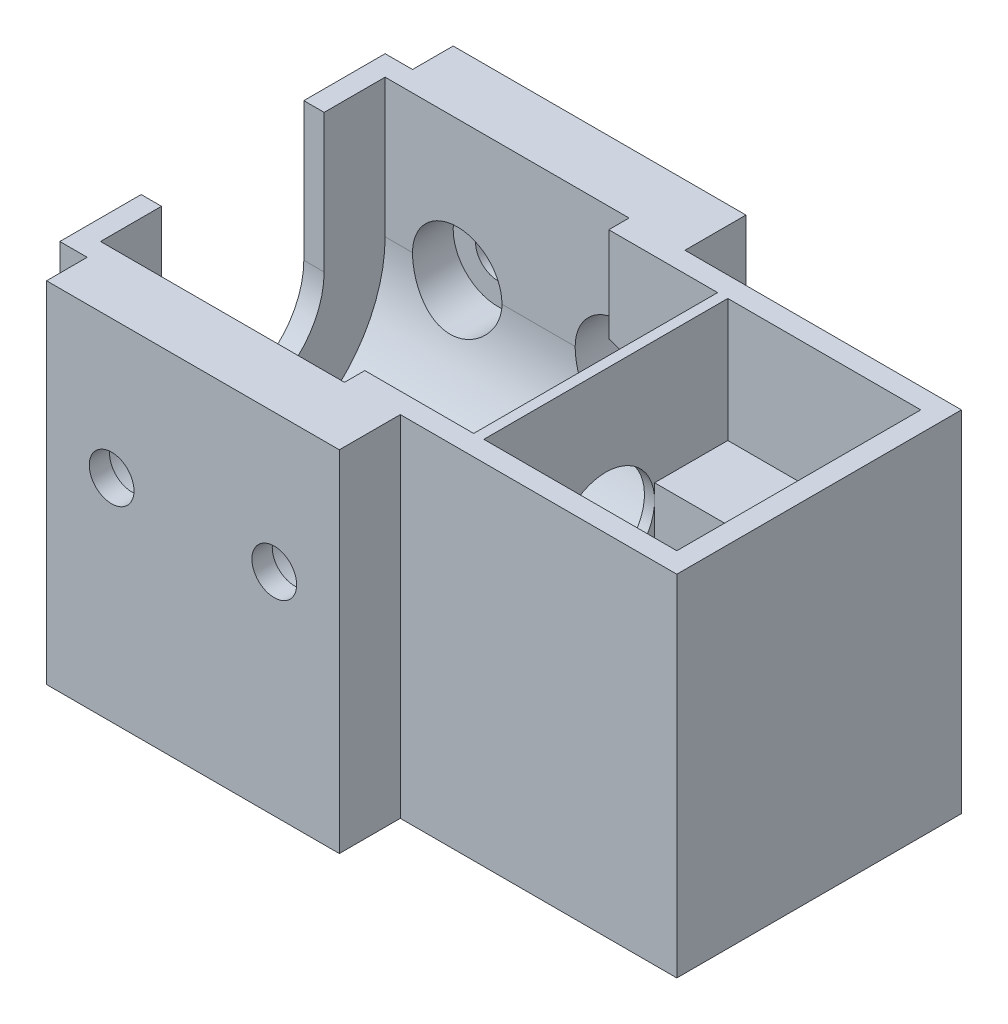
from build123d import *
from build123d.topology import SkipClean

# Parameters (mm, degrees)
SKETCH1_W                       = 116.84
SKETCH1_H                       = 50.8
BOSS_EXTRUDE1_DEPTH             = 31.75
SKETCH38_W                      = 20
SKETCH38_H                      = 20
CUT_EXTRUDE33_DEPTH             = 33.3134
SKETCH37_W                      = 63.5
SKETCH37_H                      = 25.4
CUT_EXTRUDE32_DEPTH             = 132.302277589
BOSS_EXTRUDE5_DEPTH             = 25.4
BOSS_EXTRUDE6_REACH             = 98.929
SKETCH40_W                      = 16.9009
SKETCH40_H                      = 20
SKETCH41_R                      = 3.113413941
CUT_EXTRUDE34_DEPTH             = 97.928543268
CUT_EXTRUDE35_DEPTH             = 97.928543399
CUT_EXTRUDE35_DEPTH_BACK        = 97.928543399
SKETCH42_R                      = 3.4925
SKETCH43_R                      = 6.985
CUT_EXTRUDE36_DEPTH             = 28.575
CUT_EXTRUDE37_START             = 28.575
SKETCH43_2_R                    = 6.985
CUT_EXTRUDE37_DEPTH             = 28.575
SKETCH44_W                      = 15.9125
SKETCH44_H                      = 38.1
CUT_EXTRUDE38_DEPTH             = 35.4
CUT_EXTRUDE39_REACH             = 98.929
SKETCH45_W                      = 14.2259
SKETCH45_H                      = 15.4
CUT_EXTRUDE39_DIRECTION_2_REACH = 98.929
SKETCH46_W                      = 43.18
SKETCH46_H                      = 9.525
SKETCH46_W_2                    = 27.94
SKETCH46_H_2                    = 6.35
CUT_EXTRUDE40_DEPTH             = 97.928543399
SKETCH49_W                      = 23.6641
SKETCH49_H                      = 50.8
CUT_EXTRUDE42_DEPTH             = 97.928543399
SKETCH50_W                      = 0.254
SKETCH50_H                      = 1.524
CUT_EXTRUDE43_DEPTH             = 2.54
SKETCH52_R                      = 0.3175
CUT_EXTRUDE45_DEPTH             = 0.0508
SKETCH53_R                      = 2
CUT_EXTRUDE46_DEPTH             = 0.0254
BOSS_EXTRUDE7_DEPTH             = 2.54
SKETCH55_W                      = 15.9125
SKETCH55_H                      = 9.05
BOSS_EXTRUDE8_DEPTH             = 17.46
CUT_EXTRUDE47_DEPTH             = 7.62
SKETCH58_R                      = 3.113413941
BOSS_EXTRUDE10_DEPTH            = 7.62
SKETCH59_W                      = 0.5
SKETCH59_H                      = 20
CUT_EXTRUDE48_DEPTH             = 7.62
CUT_EXTRUDE44_DEPTH             = 0.635
SKETCH60_W                      = 121.35651469
SKETCH60_H                      = 81.059088534
CUT_EXTRUDE49_DEPTH             = 10.16
SKETCH61_R                      = 8.976217823
SKETCH61_R_2                    = 7.62
BOSS_EXTRUDE11_DEPTH            = 1.5875
BOSS_EXTRUDE12_REACH            = 80.084
SKETCH62_W                      = 1.5875
SKETCH62_H                      = 15.24
SKETCH64_W                      = 30.1384
SKETCH64_H                      = 38.1
BOSS_EXTRUDE14_DEPTH            = 6.35
BOSS_EXTRUDE16_REACH            = 91.468
SKETCH65_W                      = 2.38
SKETCH65_H                      = 9.84
SKETCH66_W                      = 0.5
SKETCH66_H                      = 20
CUT_EXTRUDE50_DEPTH             = 20


with BuildPart() as part:
    # Sketch1 → Boss-Extrude1 (new, symmetric)
    with BuildSketch(Plane.XY):
        with Locations((-17.78, -25.4)):
            Rectangle(SKETCH1_W, SKETCH1_H)
    extrude(amount=BOSS_EXTRUDE1_DEPTH, both=True)

    # Sketch2 → Cut-Revolve1 (revolve, cut)
    with BuildSketch(Plane.XY, mode=Mode.PRIVATE) as cut_revolve1_sk:
        Polygon((-49.3609, -3.175), (-49.3609, -12.7), (-220.202391615, -12.7), (-220.202391615, -25.4), (-157.809194346, -25.4), (-128.417210056, -25.4), (6.8382, -25.4), (40.64, -25.4), (40.64, -17.78), (23.7391, -17.78), (5.7391, -17.78), (5.7391, -6.35), (-11.2609, -6.35), (-11.2609, -3.175), align=None)
    revolve(cut_revolve1_sk.sketch.rotate(Axis((-152.482877195, -25.4, 0), (1, 0, 0)), 180), axis=Axis((-152.482877195, -25.4, 0), (1, 0, 0)), mode=Mode.SUBTRACT)

    # Sketch38 → Cut-Extrude33 (cut)
    with BuildSketch(Plane(origin=(40.64, 0, 0), x_dir=(0, 0, -1), z_dir=(1, 0, 0))):
        with Locations((0, -25.4)):
            Rectangle(SKETCH38_W, SKETCH38_H)
    extrude(amount=-CUT_EXTRUDE33_DEPTH, mode=Mode.SUBTRACT)

    # Sketch37 → Cut-Extrude32 (cut, through all)
    with BuildSketch(Plane(origin=(40.64, 0, 0), x_dir=(0, 0, -1), z_dir=(1, 0, 0))):
        with Locations((0, -12.7)):
            Rectangle(SKETCH37_W, SKETCH37_H)
    extrude(amount=-CUT_EXTRUDE32_DEPTH, mode=Mode.SUBTRACT)

    # Sketch39 → Boss-Extrude5 (add)
    with BuildSketch(Plane(origin=(0, -25.4, 0), x_dir=(1, 0, 0), z_dir=(0, 1, 0))):
        Polygon((5.7391, 19.05), (5.7391, 7.62), (7.3266, 7.62), (7.3266, 10), (40.64, 10), (40.64, 31.75), (-76.2, 31.75), (-76.2, 12.7), (-49.3609, 12.7), (-49.3609, 22.225), (-11.2609, 22.225), (-11.2609, 19.05), align=None)
        Polygon((40.64, -10), (7.3266, -10), (7.3266, -7.62), (5.7391, -7.62), (5.7391, -19.05), (-11.2609, -19.05), (-11.2609, -22.225), (-49.3609, -22.225), (-49.3609, -12.7), (-76.2, -12.7), (-76.2, -31.75), (40.64, -31.75), align=None)
    extrude(amount=BOSS_EXTRUDE5_DEPTH)

    # Sketch40 → Boss-Extrude6 (add, up to next)
    with BuildSketch(Plane(origin=(0, 0, 0), x_dir=(1, 0, 0), z_dir=(0, 1, 0)), mode=Mode.PRIVATE) as boss_extrude6_sk1:
        with Locations((32.18955, 0)):
            Rectangle(SKETCH40_W, SKETCH40_H)
    boss_extrude6_tool1 = extrude(boss_extrude6_sk1.sketch, amount=-BOSS_EXTRUDE6_REACH, mode=Mode.PRIVATE) - part.part
    add(boss_extrude6_tool1.solids().sort_by_distance((32.18955, 0, 0))[0])

    # Sketch41 → Cut-Extrude34 (cut, through all)
    with BuildSketch(Plane(origin=(0, 0, 0), x_dir=(1, 0, 0), z_dir=(0, 1, 0))):
        with Locations(Location((-57.15, 0, 0), (0, 0, 270))):
            Circle(SKETCH41_R)
        with Locations(Location((-31.75, 0, 0), (0, 0, 270))):
            Circle(SKETCH41_R)
        with Locations(Location((-6.35, 0, 0), (0, 0, 270))):
            Circle(SKETCH41_R)
    extrude(amount=-CUT_EXTRUDE34_DEPTH, mode=Mode.SUBTRACT)

    # Sketch42 → Cut-Extrude35 (cut, two sides: drawn at the far end of the back side and taken through both)
    with BuildSketch(Plane.XY.offset(-CUT_EXTRUDE35_DEPTH_BACK)):
        with Locations((-38.1, -25.4)):
            Circle(SKETCH42_R)
        with Locations((-12.7, -25.4)):
            Circle(SKETCH42_R)
    extrude(amount=CUT_EXTRUDE35_DEPTH + CUT_EXTRUDE35_DEPTH_BACK, mode=Mode.SUBTRACT)

    # Sketch43 → Cut-Extrude36 (cut)
    with BuildSketch(Plane.XY):
        with Locations(Location((-38.1, -25.4, 0), (0, 0, 180))):
            Circle(SKETCH43_R)
        with Locations(Location((-12.7, -25.4, 0), (0, 0, 180))):
            Circle(SKETCH43_R)
    extrude(amount=-CUT_EXTRUDE36_DEPTH, mode=Mode.SUBTRACT)

    # Sketch43<2> → Cut-Extrude37 (cut)
    with BuildSketch(Plane.XY.offset(CUT_EXTRUDE37_START)):
        with Locations(Location((-38.1, -25.4, 0), (0, 0, 180))):
            Circle(SKETCH43_2_R)
        with Locations(Location((-12.7, -25.4, 0), (0, 0, 180))):
            Circle(SKETCH43_2_R)
    extrude(amount=-CUT_EXTRUDE37_DEPTH, mode=Mode.SUBTRACT)

    # Sketch44 → Cut-Extrude38 (cut)
    with BuildSketch(Plane(origin=(0, 0, 0), x_dir=(1, 0, 0), z_dir=(0, 1, 0))):
        with Locations((15.28285, 0)):
            Rectangle(SKETCH44_W, SKETCH44_H)
    extrude(amount=-CUT_EXTRUDE38_DEPTH, mode=Mode.SUBTRACT)

    # Cut-Extrude39: up to this face of the body (flat: up to its plane)
    cut_extrude39_end = Plane(part.part.faces().sort_by_distance((15.28285, -17.7, -19.05))[0])
    # Sketch45 → Cut-Extrude39 (cut, up to the picked face)
    with BuildSketch(Plane.XY, mode=Mode.PRIVATE) as cut_extrude39_sk1:
        with Locations((30.35205, -7.7)):
            Rectangle(SKETCH45_W, SKETCH45_H)
    cut_extrude39_tool1 = split(extrude(cut_extrude39_sk1.sketch, amount=-CUT_EXTRUDE39_REACH, mode=Mode.PRIVATE), bisect_by=cut_extrude39_end, keep=Keep.BOTH, mode=Mode.PRIVATE)
    add(cut_extrude39_tool1.solids().sort_by(Axis((30.35205, -7.7, 0), (0, 0, -1)))[0], mode=Mode.SUBTRACT)

    # Cut-Extrude39 direction 2: up to this face of the body (flat: up to its plane)
    cut_extrude39_direction_2_end = Plane(part.part.faces().sort_by_distance((15.28285, -17.7, 19.05))[0])
    # Sketch45 → Cut-Extrude39 direction 2 (cut, up to the picked face)
    with BuildSketch(Plane.XY, mode=Mode.PRIVATE) as cut_extrude39_direction_2_sk1:
        with Locations((30.35205, -7.7)):
            Rectangle(SKETCH45_W, SKETCH45_H)
    cut_extrude39_direction_2_tool1 = split(extrude(cut_extrude39_direction_2_sk1.sketch, amount=CUT_EXTRUDE39_DIRECTION_2_REACH, mode=Mode.PRIVATE), bisect_by=cut_extrude39_direction_2_end, keep=Keep.BOTH, mode=Mode.PRIVATE)
    add(cut_extrude39_direction_2_tool1.solids().sort_by(Axis((30.35205, -7.7, 0), (0, 0, 1)))[0], mode=Mode.SUBTRACT)

    # Sketch46 → Cut-Extrude40 (cut, through all)
    with BuildSketch(Plane(origin=(0, 0, 0), x_dir=(1, 0, 0), z_dir=(0, 1, 0))):
        with Locations((19.05, 26.9875)):
            Rectangle(SKETCH46_W, SKETCH46_H)
        with Locations((19.05, -26.9875)):
            Rectangle(SKETCH46_W, SKETCH46_H)
        with Locations((-62.23, 28.575)):
            Rectangle(SKETCH46_W_2, SKETCH46_H_2)
        with Locations((-62.23, -28.575)):
            Rectangle(SKETCH46_W_2, SKETCH46_H_2)
    extrude(amount=-CUT_EXTRUDE40_DEPTH, mode=Mode.SUBTRACT)

    # Sketch49 → Cut-Extrude42 (cut, through all)
    with BuildSketch(Plane(origin=(0, 0, 0), x_dir=(1, 0, 0), z_dir=(0, 1, 0))):
        with Locations((-64.36795, 0)):
            Rectangle(SKETCH49_W, SKETCH49_H)
    extrude(amount=-CUT_EXTRUDE42_DEPTH, mode=Mode.SUBTRACT)

    # Sketch50 → Cut-Extrude43 (cut)
    with BuildSketch(Plane(origin=(0, 0, 0), x_dir=(1, 0, 0), z_dir=(0, 1, 0))):
        with Locations((23.1121, 21.463)):
            Rectangle(SKETCH50_W, SKETCH50_H)
        with Locations((21.5881, 21.463)):
            Rectangle(SKETCH50_W, SKETCH50_H)
        with Locations((20.0641, 21.463)):
            Rectangle(SKETCH50_W, SKETCH50_H)
        with Locations((18.5401, 21.463)):
            Rectangle(SKETCH50_W, SKETCH50_H)
        with Locations((17.0161, 21.463)):
            Rectangle(SKETCH50_W, SKETCH50_H)
        with Locations((15.4921, 21.463)):
            Rectangle(SKETCH50_W, SKETCH50_H)
        with Locations((13.9681, 21.463)):
            Rectangle(SKETCH50_W, SKETCH50_H)
        with Locations((12.4441, 21.463)):
            Rectangle(SKETCH50_W, SKETCH50_H)
        with Locations((10.9201, 21.463)):
            Rectangle(SKETCH50_W, SKETCH50_H)
        with Locations((9.3961, 21.463)):
            Rectangle(SKETCH50_W, SKETCH50_H)
    extrude(amount=-CUT_EXTRUDE43_DEPTH, mode=Mode.SUBTRACT)

    # Sketch52 → Cut-Extrude45 (cut)
    with BuildSketch(Plane.ZY.offset(-23.7391)):
        with Locations(Location((0, -25.4, 0), (0, 0, 270))):
            Circle(SKETCH52_R)
    extrude(amount=-CUT_EXTRUDE45_DEPTH, mode=Mode.SUBTRACT)

    # Sketch53 → Cut-Extrude46 (cut)
    with BuildSketch(Plane.ZY.offset(-23.7391)):
        with Locations(Location((0, -25.4, 0), (0, 0, 270))):
            Circle(SKETCH53_R)
    extrude(amount=-CUT_EXTRUDE46_DEPTH, mode=Mode.SUBTRACT)

    # Sketch54 → Boss-Extrude7 (add)
    with BuildSketch(Plane(origin=(0, -35.4, 0), x_dir=(1, 0, 0), z_dir=(0, 1, 0))):
        Polygon((23.2391, 10), (23.2391, -10), (23.2391, -19.05), (7.3266, -19.05), (7.3266, 19.05), (23.2391, 19.05), align=None)
    extrude(amount=BOSS_EXTRUDE7_DEPTH)

    # Sketch55 → Boss-Extrude8 (add)
    with BuildSketch(Plane(origin=(0, -32.86, 0), x_dir=(1, 0, 0), z_dir=(0, 1, 0))):
        with Locations((15.28285, 14.525)):
            Rectangle(SKETCH55_W, SKETCH55_H)
        with Locations((15.28285, -14.525)):
            Rectangle(SKETCH55_W, SKETCH55_H)
    extrude(amount=BOSS_EXTRUDE8_DEPTH)

    # Sketch57 → Cut-Extrude47 (cut)
    with BuildSketch(Plane(origin=(0, -15.4, 0), x_dir=(1, 0, 0), z_dir=(0, 1, 0))):
        Polygon((23.7391, -10), (7.3266, -10), (7.3266, -19.05), (37.465, -19.05), (37.465, 19.05), (7.3266, 19.05), (7.3266, 10), (23.7391, 10), align=None)
    extrude(amount=-CUT_EXTRUDE47_DEPTH, mode=Mode.SUBTRACT)

    # Sketch58 → Boss-Extrude10 (add)
    with SkipClean():  # the faces are left unmerged after this step: merging them gives an invalid solid
        with BuildSketch(Plane.XZ.offset(50.8)):
            Polygon((-48.26, 25.4), (-52.5359, 25.4), (-52.5359, -25.4), (-48.26, -25.4), (-48.26, -31.75), (-2.54, -31.75), (-2.54, -22.225), (40.64, -22.225), (40.64, 22.225), (-2.54, 22.225), (-2.54, 31.75), (-48.26, 31.75), align=None)
            with Locations((-31.75, 0)):
                Circle(SKETCH58_R, mode=Mode.SUBTRACT)
            with Locations(Location((-6.35, 0, 0), (0, 0, 90))):
                Circle(SKETCH58_R, mode=Mode.SUBTRACT)
        extrude(amount=BOSS_EXTRUDE10_DEPTH)

    # Sketch59 → Cut-Extrude48 (cut)
    with SkipClean():  # the faces are left unmerged after this step: merging them gives an invalid solid
        with BuildSketch(Plane(origin=(0, -35.4, 0), x_dir=(1, 0, 0), z_dir=(0, 1, 0))):
            with Locations((23.4891, 0)):
                Rectangle(SKETCH59_W, SKETCH59_H)
        extrude(amount=-CUT_EXTRUDE48_DEPTH, mode=Mode.SUBTRACT)

    # Sketch51 → Cut-Extrude44 (cut)
    # profile 1 of 3: a face of its own
    with SkipClean():  # the faces are left unmerged after this step: merging them gives an invalid solid
        with BuildSketch(Plane(origin=(0, -23.02, 0), x_dir=(1, 0, 0), z_dir=(0, 1, 0))):
            Polygon((25.098, 0.254), (26.10821862, 0.254), (26.10821862, 2.54), (26.61621862, 2.54), (26.61621862, 0.254), (27.62643724, 0.254), (27.62643724, 2.54), (28.13443724, 2.54), (28.13443724, 0.254), (29.14465586, 0.254), (29.14465586, 2.54), (29.65265586, 2.54), (29.65265586, 0.254), (30.66287448, 0.254), (30.66287448, 2.54), (31.17087448, 2.54), (31.17087448, 0.254), (32.1810931, 0.254), (32.1810931, 2.54), (32.6890931, 2.54), (32.6890931, 0.254), (33.69931172, 0.254), (33.69931172, 2.54), (34.20731172, 2.54), (34.20731172, 0.254), (35.21753034, 0.254), (35.21753034, 2.54), (35.72553034, 2.54), (35.72553034, 0.254), (37.465, 0.254), (37.465, -0.254), (35.72553034, -0.254), (35.72553034, -2.54), (35.21753034, -2.54), (35.21753034, -0.254), (34.20731172, -0.254), (34.20731172, -2.54), (33.69931172, -2.54), (33.69931172, -0.254), (32.6890931, -0.254), (32.6890931, -2.54), (32.1810931, -2.54), (32.1810931, -0.254), (31.17087448, -0.254), (31.17087448, -2.54), (30.66287448, -2.54), (30.66287448, -0.254), (29.65265586, -0.254), (29.65265586, -2.54), (29.14465586, -2.54), (29.14465586, -0.254), (28.13443724, -0.254), (28.13443724, -2.54), (27.62643724, -2.54), (27.62643724, -0.254), (26.61621862, -0.254), (26.61621862, -2.54), (26.10821862, -2.54), (26.10821862, -0.254), (25.098, -0.254), (25.098, -2.54), (24.59, -2.54), (24.59, -0.254), (23.7391, -0.254), (23.7391, 0.254), (24.59, 0.254), (24.59, 2.54), (25.098, 2.54), align=None)
        # profile 2 of 3: a face of its own
        with BuildSketch(Plane(origin=(0, -23.02, 0), x_dir=(1, 0, 0), z_dir=(0, 1, 0))):
            Polygon((27.745064103, 14.333054385), (28.384487179, 14.333054385), (29.046346154, 12.82353916), (29.708205128, 14.333054385), (30.347628205, 14.333054385), (29.227235577, 11.775362077), (28.865456731, 11.775362077), align=None)
        # profile 3 of 3: a face of its own
        with BuildSketch(Plane(origin=(0, -23.02, 0), x_dir=(1, 0, 0), z_dir=(0, 1, 0))):
            with BuildLine():
                Line((31.68536859, 11.685618487), (31.128677885, 11.966067205))
                Line((31.128677885, 11.966067205), (31.738653846, 13.166387718))
                add(Edge.make_bspline(
                    [(31.738653846, 13.166387718), (31.702615066, 13.167306298), (31.631862221, 13.169109694), (31.527684177, 13.184095898), (31.428061222, 13.209678305), (31.331819129, 13.243734933), (31.240288895, 13.289391372), (31.152360645, 13.343879937), (31.069251601, 13.409347163), (30.9905721, 13.482935032), (30.918735202, 13.564273448), (30.856382294, 13.651751537), (30.802034562, 13.743150237), (30.759770785, 13.84053294), (30.725824304, 13.942084674), (30.701021294, 14.048331082), (30.6871025, 14.159738305), (30.685157047, 14.235560842), (30.684166667, 14.274160154)],
                    knots=[0, 0, 0, 0, 1.014336294, 1.991387562, 2.955278539, 3.906441712, 4.859855302, 5.829322156, 6.813833455, 7.833278715, 8.858926674, 9.863225732, 10.85404919, 11.846815163, 12.845559416, 13.865450493, 14.913355531, 16, 16, 16, 16], degree=3))
                add(Edge.make_bspline(
                    [(30.684166667, 14.274160154), (30.685085298, 14.311601105), (30.686895444, 14.385377726), (30.701928873, 14.493657796), (30.726670007, 14.597622482), (30.760613956, 14.697254123), (30.80580199, 14.791880885), (30.858693434, 14.882984404), (30.923350825, 14.968679845), (30.99639168, 15.049338185), (31.076331019, 15.123126325), (31.161139948, 15.188004132), (31.250432852, 15.242235744), (31.34306223, 15.287780294), (31.440702424, 15.321808349), (31.541942425, 15.347482264), (31.647536403, 15.362299782), (31.719211393, 15.364162888), (31.755480769, 15.365105667)],
                    knots=[0, 0, 0, 0, 1.055538678, 2.079917126, 3.075849687, 4.065898488, 5.041806164, 6.028602842, 7.031727914, 8.062953097, 9.093756959, 10.095582084, 11.068815425, 12.035667573, 13.000833448, 13.979119574, 14.977382875, 16, 16, 16, 16], degree=3))
                add(Edge.make_bspline(
                    [(31.755480769, 15.365105667), (31.793404789, 15.364325042), (31.867977244, 15.362790048), (31.977141303, 15.345852002), (32.081585056, 15.319865941), (32.181732875, 15.284571569), (32.276341468, 15.2366698), (32.366202469, 15.179259197), (32.451016973, 15.111069512), (32.529874134, 15.034066183), (32.601593841, 14.950310656), (32.665164437, 14.862638824), (32.718566437, 14.771222111), (32.762305941, 14.67687638), (32.796378795, 14.579453826), (32.819799539, 14.47881626), (32.835348316, 14.375135777), (32.837117456, 14.304832747), (32.838012821, 14.269252301)],
                    knots=[0, 0, 0, 0, 1.062826075, 2.08990367, 3.089830715, 4.078784409, 5.060762809, 6.057138927, 7.064407536, 8.107320944, 9.143871033, 10.153461498, 11.140480137, 12.108246174, 13.065926856, 14.029354859, 15.002654194, 16, 16, 16, 16], degree=3))
                add(Edge.make_bspline(
                    [(32.838012821, 14.269252301), (32.837524212, 14.24211594), (32.836540045, 14.187457208), (32.826862963, 14.105490514), (32.812180881, 14.023296642), (32.795139217, 13.95419198), (32.777273404, 13.895940949), (32.759887932, 13.846525751), (32.73758186, 13.791665603), (32.712674901, 13.730992791), (32.683829712, 13.664773371), (32.650448239, 13.593323898), (32.614547969, 13.515584705), (32.588085926, 13.462427705), (32.574391026, 13.434917365)],
                    knots=[0, 0, 0, 0, 1.105131805, 2.225983929, 3.357782449, 4.505488967, 5.122909461, 5.839607681, 6.638776516, 7.535249922, 8.51168636, 9.581005249, 10.748097757, 12, 12, 12, 12], degree=3))
                Line((32.574391026, 13.434917365), (31.68536859, 11.685618487))
            make_face()
            with BuildLine():
                add(Edge.make_bspline(
                    [(31.769503205, 13.749721051), (31.799604178, 13.751493183), (31.858414662, 13.754955526), (31.942892013, 13.781727105), (32.018494946, 13.827540547), (32.08550457, 13.888404315), (32.140879273, 13.962660897), (32.181140305, 14.047195414), (32.205939862, 14.14025725), (32.20849365, 14.205059289), (32.209807692, 14.238402942)],
                    knots=[0, 0, 0, 0, 0.984774978, 1.924027336, 2.867853169, 3.859505234, 4.871392407, 5.881338128, 6.909850265, 8, 8, 8, 8], degree=3))
                add(Edge.make_bspline(
                    [(32.209807692, 14.238402942), (32.208225071, 14.27244022), (32.205146496, 14.338650852), (32.18010937, 14.433946529), (32.137325957, 14.520088169), (32.079121571, 14.594968976), (32.01116871, 14.657634646), (31.935180258, 14.70341023), (31.853001374, 14.731716384), (31.796130711, 14.735160555), (31.76739984, 14.736900538)],
                    knots=[0, 0, 0, 0, 1.104110315, 2.147758178, 3.172670271, 4.206310416, 5.210906102, 6.157051016, 7.068948237, 8, 8, 8, 8], degree=3))
                add(Edge.make_bspline(
                    [(31.76739984, 14.736900538), (31.737032921, 14.735204279), (31.677407724, 14.731873687), (31.59188113, 14.703635508), (31.513039036, 14.658738968), (31.444188027, 14.595860676), (31.384600119, 14.521966025), (31.343047844, 14.435533619), (31.316760434, 14.340902953), (31.313860978, 14.274573584), (31.312371795, 14.240506308)],
                    knots=[0, 0, 0, 0, 0.970967322, 1.90648639, 2.855811969, 3.858352357, 4.877096915, 5.878517833, 6.91039038, 8, 8, 8, 8], degree=3))
                add(Edge.make_bspline(
                    [(31.312371795, 14.240506308), (31.313927339, 14.206924635), (31.316952709, 14.14161179), (31.342308388, 14.048022164), (31.383610248, 13.963040283), (31.440072838, 13.888198083), (31.509620843, 13.827034433), (31.58858725, 13.781708996), (31.676672449, 13.754882935), (31.7380026, 13.751472652), (31.769503205, 13.749721051)],
                    knots=[0, 0, 0, 0, 1.075706617, 2.092137047, 3.084482865, 4.090466434, 5.0784141, 6.035155512, 6.990809768, 8, 8, 8, 8], degree=3))
            make_face(mode=Mode.SUBTRACT)
        extrude(amount=-CUT_EXTRUDE44_DEPTH, mode=Mode.SUBTRACT)

    # Sketch60 → Cut-Extrude49 (cut)
    with SkipClean():  # the faces are left unmerged after this step: merging them gives an invalid solid
        with BuildSketch(Plane(origin=(0, 0, 0), x_dir=(1, 0, 0), z_dir=(0, 1, 0))):
            Rectangle(SKETCH60_W, SKETCH60_H)
        extrude(amount=-CUT_EXTRUDE49_DEPTH, mode=Mode.SUBTRACT)

    # Sketch61 → Boss-Extrude11 (add)
    with SkipClean():  # the faces are left unmerged after this step: merging them gives an invalid solid
        with BuildSketch(Plane.ZY.offset(-5.7391)):
            with Locations((0, -25.4)):
                Circle(SKETCH61_R)
            with Locations(Location((0, -25.4, 0), (0, 0, 270))):
                Circle(SKETCH61_R_2, mode=Mode.SUBTRACT)
        extrude(amount=-BOSS_EXTRUDE11_DEPTH)

    # Sketch62 → Boss-Extrude12 (add, up to next)
    with BuildSketch(Plane(origin=(0, -10.16, 0), x_dir=(1, 0, 0), z_dir=(0, 1, 0)), mode=Mode.PRIVATE) as boss_extrude12_sk1:
        with Locations((6.53285, 0)):
            Rectangle(SKETCH62_W, SKETCH62_H)
    boss_extrude12_tool1 = extrude(boss_extrude12_sk1.sketch, amount=-BOSS_EXTRUDE12_REACH, mode=Mode.PRIVATE) - part.part
    add(boss_extrude12_tool1.solids().sort_by_distance((6.53285, -10.16, 0))[0])

    # Sketch64 → Boss-Extrude14 (add)
    with BuildSketch(Plane(origin=(0, -10.16, 0), x_dir=(1, 0, 0), z_dir=(0, 1, 0))):
        Polygon((-11.2609, 19.05), (5.7391, 19.05), (5.7391, -19.05), (-11.2609, -19.05), (-11.2609, -22.225), (-49.3609, -22.225), (-49.3609, -12.7), (-52.5359, -12.7), (-52.5359, -25.4), (-48.26, -25.4), (-48.26, -31.75), (-2.54, -31.75), (-2.54, -22.225), (40.64, -22.225), (40.64, 22.225), (-2.54, 22.225), (-2.54, 31.75), (-48.26, 31.75), (-48.26, 25.4), (-52.5359, 25.4), (-52.5359, 12.7), (-49.3609, 12.7), (-49.3609, 22.225), (-11.2609, 22.225), align=None)
        with Locations((22.3958, 0)):
            Rectangle(SKETCH64_W, SKETCH64_H, mode=Mode.SUBTRACT)
    extrude(amount=BOSS_EXTRUDE14_DEPTH)

    # Sketch65 → Boss-Extrude16 (add, up to next)
    with BuildSketch(Plane(origin=(7.3266, 0, 0), x_dir=(0, 0, -1), z_dir=(1, 0, 0)), mode=Mode.PRIVATE) as boss_extrude16_sk1:
        with Locations((-8.81, -27.94)):
            Rectangle(SKETCH65_W, SKETCH65_H)
    boss_extrude16_tool1 = extrude(boss_extrude16_sk1.sketch, amount=BOSS_EXTRUDE16_REACH, mode=Mode.PRIVATE) - part.part
    # Sketch65 → Boss-Extrude16 (add, up to next)
    with BuildSketch(Plane(origin=(7.3266, 0, 0), x_dir=(0, 0, -1), z_dir=(1, 0, 0)), mode=Mode.PRIVATE) as boss_extrude16_sk2:
        with Locations((8.81, -27.94)):
            Rectangle(SKETCH65_W, SKETCH65_H)
    boss_extrude16_tool2 = extrude(boss_extrude16_sk2.sketch, amount=BOSS_EXTRUDE16_REACH, mode=Mode.PRIVATE) - part.part
    add(boss_extrude16_tool1.solids().sort_by_distance((7.3266, -27.94, 8.81))[0])
    add(boss_extrude16_tool2.solids().sort_by_distance((7.3266, -27.94, -8.81))[0])

    # Sketch66 → Cut-Extrude50 (cut)
    with BuildSketch(Plane(origin=(0, -23.02, 0), x_dir=(1, 0, 0), z_dir=(0, 1, 0))):
        with Locations((23.4891, 0)):
            Rectangle(SKETCH66_W, SKETCH66_H)
    extrude(amount=-CUT_EXTRUDE50_DEPTH, mode=Mode.SUBTRACT)


solid = part.part
